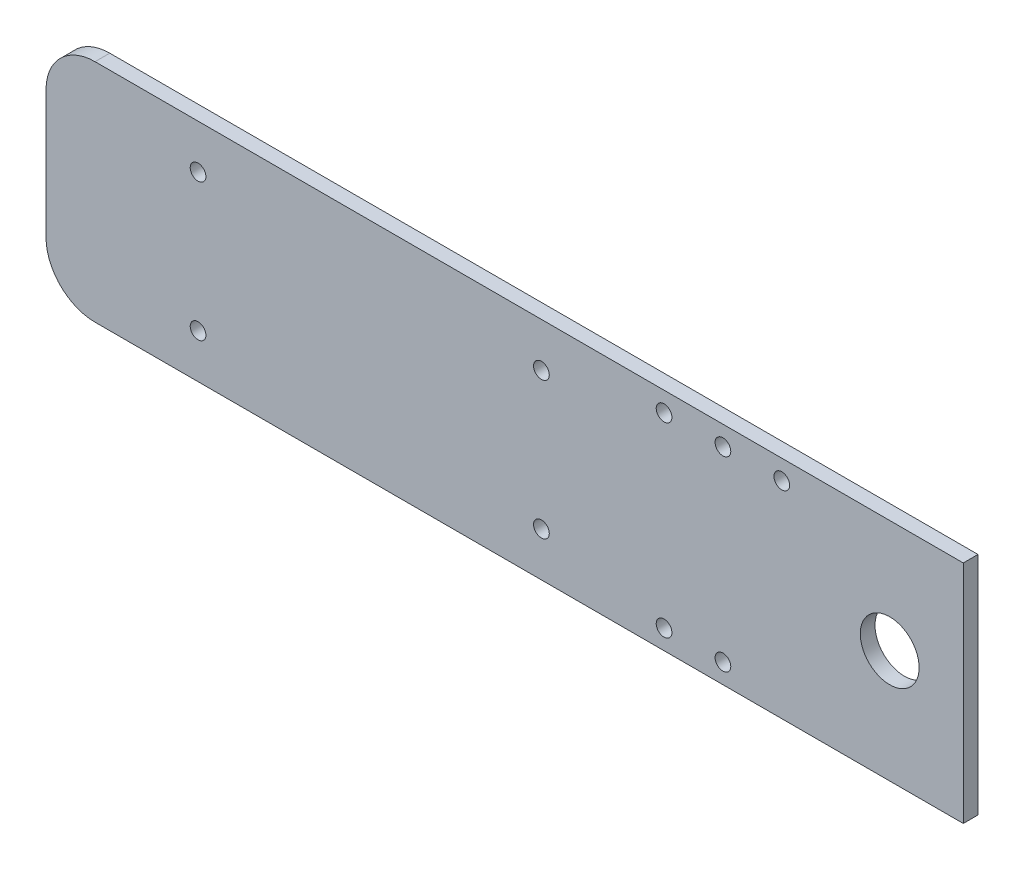
from build123d import *

# Parameters (mm, degrees)
SKETCH2_W           = 142
SKETCH2_H           = 46
SKETCH2_R           = 1.6
BOSS_EXTRUDE1_DEPTH = 3
FILLET4_R           = 10
SKETCH3_R           = 6
BOSS_EXTRUDE2_DEPTH = 3
SKETCH3_7_R         = 1.6
CUT_EXTRUDE1_DEPTH  = 3


with BuildPart() as part:
    # Sketch2 → Boss-Extrude1 (new body)
    with BuildSketch(Plane.XY):
        with Locations((15, 0)):
            Rectangle(SKETCH2_W, SKETCH2_H)
        with Locations((-25, -14)):
            Circle(SKETCH2_R, mode=Mode.SUBTRACT)
        with Locations((45, -14)):
            Circle(SKETCH2_R, mode=Mode.SUBTRACT)
        with Locations((-25, 14)):
            Circle(SKETCH2_R, mode=Mode.SUBTRACT)
        with Locations((45, 14)):
            Circle(SKETCH2_R, mode=Mode.SUBTRACT)
    extrude(amount=BOSS_EXTRUDE1_DEPTH)

    # Fillet4
    fillet4_edges = [part.edges().sort_by_distance(p)[0] for p in [
        (-56, -23, 1.5),
        (-56, 23, 1.5),
    ]]
    fillet(fillet4_edges, radius=FILLET4_R)

    # Sketch3 → Boss-Extrude2 (add)
    with BuildSketch(Plane.XY.offset(3)):
        Polygon((86, 23), (86, 19), (86, -23), (131, -23), (131, 23), align=None)
        with Locations((116, 0)):
            Circle(SKETCH3_R, mode=Mode.SUBTRACT)
    extrude(amount=-BOSS_EXTRUDE2_DEPTH)

    # Sketch3<7> → Cut-Extrude1 (cut)
    with BuildSketch(Plane.XY.offset(3)):
        with Locations((94, 19)):
            Circle(SKETCH3_7_R)
        with Locations((82, 19)):
            Circle(SKETCH3_7_R)
        with Locations((70, 19)):
            Circle(SKETCH3_7_R)
        with Locations((82, -19)):
            Circle(SKETCH3_7_R)
        with Locations((70, -19)):
            Circle(SKETCH3_7_R)
    extrude(amount=-CUT_EXTRUDE1_DEPTH, mode=Mode.SUBTRACT)


solid = part.part
